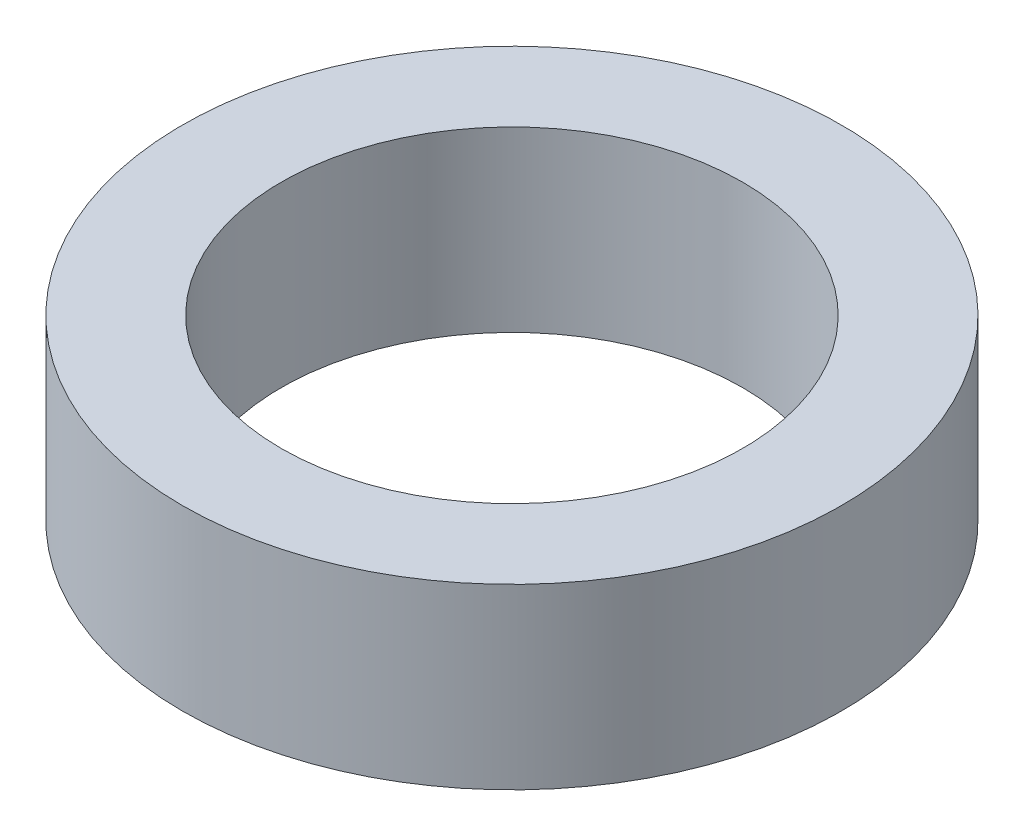
from build123d import *

# Parameters (mm, degrees)
SKETCH1_R           = 50
BOSS_EXTRUDE1_DEPTH = 27
SKETCH2_R           = 35
CUT_EXTRUDE1_DEPTH  = 76.690157881


with BuildPart() as part:
    # Sketch1 → Boss-Extrude1 (new body)
    with BuildSketch(Plane(origin=(0, 0, 0), x_dir=(1, 0, 0), z_dir=(0, 1, 0))):
        Circle(SKETCH1_R)
    extrude(amount=BOSS_EXTRUDE1_DEPTH)

    # Sketch2 → Cut-Extrude1 (cut, through all)
    with BuildSketch(Plane(origin=(0, 0, 0), x_dir=(1, 0, 0), z_dir=(0, 1, 0))):
        Circle(SKETCH2_R)
    extrude(amount=CUT_EXTRUDE1_DEPTH, mode=Mode.SUBTRACT)


solid = part.part
